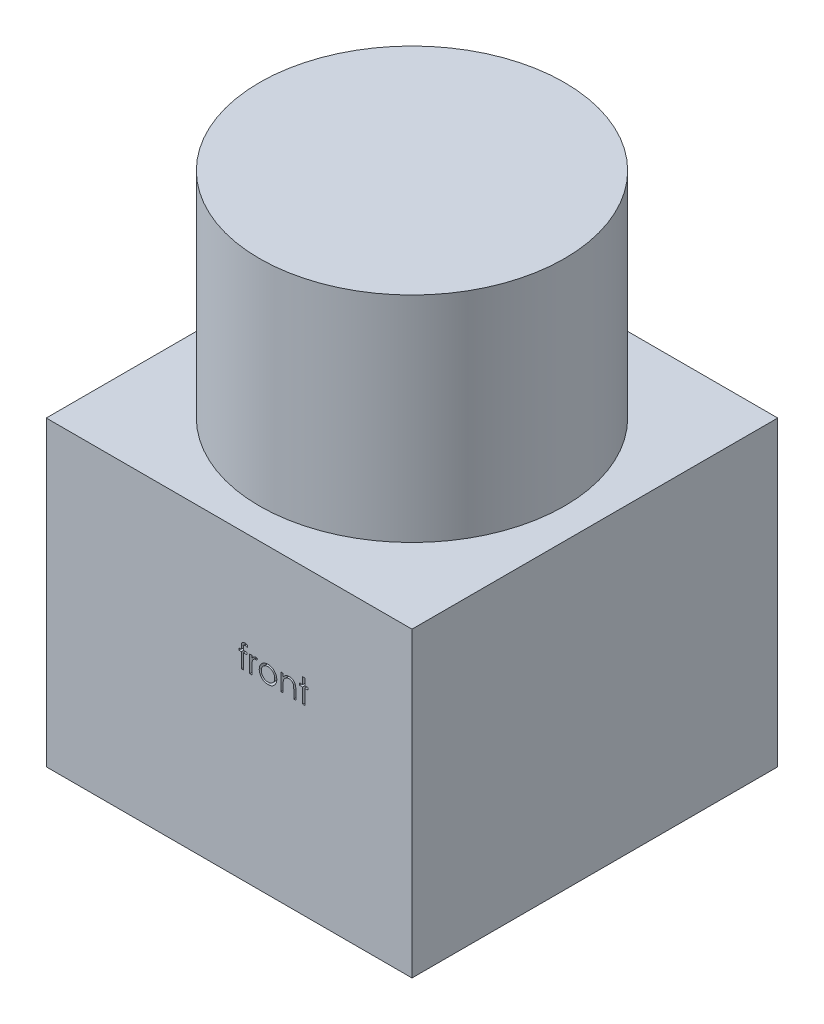
from build123d import *

# Parameters (mm, degrees)
SKETCH1_W           = 50
SKETCH1_H           = 41.3
BOSS_EXTRUDE1_DEPTH = 50
SKETCH2_R           = 20.85
BOSS_EXTRUDE2_DEPTH = 29.3
SKETCH3_R           = 1.7
CUT_EXTRUDE1_DEPTH  = 12.7
CUT_EXTRUDE2_DEPTH  = 2.54


with BuildPart() as part:
    # Sketch1 → Boss-Extrude1 (new body)
    with BuildSketch(Plane.XY):
        with Locations((25, 20.65)):
            Rectangle(SKETCH1_W, SKETCH1_H)
    extrude(amount=BOSS_EXTRUDE1_DEPTH)

    # Sketch2 → Boss-Extrude2 (add)
    with BuildSketch(Plane(origin=(0, 41.3, 0), x_dir=(1, 0, 0), z_dir=(0, 1, 0))):
        with Locations((25, -25)):
            Circle(SKETCH2_R)
    extrude(amount=BOSS_EXTRUDE2_DEPTH)

    # Sketch3 → Cut-Extrude1 (cut)
    with BuildSketch(Plane.XZ):
        with Locations((45.86404504, 45.86404504)):
            Circle(SKETCH3_R)
        with Locations((4.13595496, 4.13595496)):
            Circle(SKETCH3_R)
    extrude(amount=-CUT_EXTRUDE1_DEPTH, mode=Mode.SUBTRACT)

    # Sketch4 → Cut-Extrude2 (cut)
    # profile 1 of 5: a face of its own
    with BuildSketch(Plane.XY.offset(50)):
        with BuildLine():
            Line((27.486215918, 28.180376343), (27.486215918, 27.883992128))
            add(Edge.make_bspline(
                [(27.486215918, 27.883992128), (27.459238597, 27.894833276), (27.408035081, 27.915410001), (27.332524168, 27.93778434), (27.263101583, 27.952240333), (27.218511983, 27.954268654), (27.197463915, 27.955226102)],
                knots=[0, 0, 0, 0, 1.16548392, 2.212112691, 3.15604595, 4, 4, 4, 4], degree=3))
            add(Edge.make_bspline(
                [(27.197463915, 27.955226102), (27.183245572, 27.954635244), (27.155723602, 27.953491539), (27.116169156, 27.947660174), (27.08052823, 27.935774062), (27.048863845, 27.920326075), (27.022601642, 27.90095478), (27.000116996, 27.881491791), (26.983818787, 27.859552377), (26.974969656, 27.839123148), (26.969572155, 27.820208318), (26.967948253, 27.800836948), (26.96397051, 27.777047955), (26.962861249, 27.747870868), (26.960332708, 27.714213409), (26.960556447, 27.675363296), (26.958484602, 27.631931888), (26.958794767, 27.601179247), (26.958957304, 27.585063843)],
                knots=[0, 0, 0, 0, 1.311993654, 2.539582093, 3.670788641, 4.763509788, 5.772417512, 6.671800701, 7.496729179, 8.266799162, 8.712543678, 9.304149002, 10.05334463, 10.934920737, 11.99209668, 13.165090968, 14.514413552, 16, 16, 16, 16], degree=3))
            Line((26.958957304, 27.585063843), (26.958957304, 27.263238923))
            Line((26.958957304, 27.263238923), (27.44551079, 27.263238923))
            Line((27.44551079, 27.263238923), (27.44551079, 26.978303025))
            Line((27.44551079, 26.978303025), (26.958321287, 26.978303025))
            Line((26.958321287, 26.978303025), (26.957049251, 24.943046615))
            Line((26.957049251, 24.943046615), (26.672113354, 24.943046615))
            Line((26.672113354, 24.943046615), (26.672113354, 26.978303025))
            Line((26.672113354, 26.978303025), (26.346472328, 26.978303025))
            Line((26.346472328, 26.978303025), (26.346472328, 27.263238923))
            Line((26.346472328, 27.263238923), (26.672113354, 27.263238923))
            Line((26.672113354, 27.263238923), (26.672113354, 27.6340372))
            add(Edge.make_bspline(
                [(26.672113354, 27.6340372), (26.672136227, 27.65460719), (26.672180107, 27.694068725), (26.675253371, 27.750864431), (26.677880203, 27.803318574), (26.683112266, 27.851023977), (26.689155385, 27.894427264), (26.697806044, 27.932883663), (26.705980645, 27.967429259), (26.720811153, 28.006529526), (26.742965595, 28.050843477), (26.77882513, 28.097673728), (26.821817359, 28.139678931), (26.873169195, 28.175064172), (26.930968288, 28.204469641), (26.995267642, 28.225553322), (27.065367286, 28.237473583), (27.113888062, 28.23924633), (27.138950293, 28.240162)],
                knots=[0, 0, 0, 0, 1.116398763, 2.141702935, 3.087165306, 3.966655413, 4.746276475, 5.464069668, 6.106083417, 6.67047701, 7.730773247, 8.782666744, 9.856985883, 10.980834087, 12.154321827, 13.366232824, 14.639591414, 16, 16, 16, 16], degree=3))
            add(Edge.make_bspline(
                [(27.138950293, 28.240162), (27.164419924, 28.239293519), (27.217892062, 28.237470189), (27.301527551, 28.226191312), (27.391875821, 28.206714021), (27.453866263, 28.189407654), (27.486215918, 28.180376343)],
                knots=[0, 0, 0, 0, 0.864728408, 1.815451418, 2.859995356, 4, 4, 4, 4], degree=3))
        make_face()
    # profile 2 of 5: a face of its own
    with BuildSketch(Plane.XY.offset(50)):
        with BuildLine():
            Line((27.811856944, 27.263238923), (28.096792841, 27.263238923))
            Line((28.096792841, 27.263238923), (28.096792841, 26.921697456))
            add(Edge.make_bspline(
                [(28.096792841, 26.921697456), (28.117828358, 26.953498101), (28.15805862, 27.014316586), (28.224926778, 27.094752309), (28.293419085, 27.161350244), (28.363863434, 27.214421293), (28.436777853, 27.254166051), (28.510562088, 27.283279018), (28.586376978, 27.300494154), (28.637323867, 27.302792545), (28.66284853, 27.303944051)],
                knots=[0, 0, 0, 0, 1.2804753, 2.448899062, 3.506932113, 4.484331642, 5.4025378, 6.288909075, 7.142734305, 8, 8, 8, 8], degree=3))
            add(Edge.make_bspline(
                [(28.66284853, 27.303944051), (28.682648126, 27.302864073), (28.723387082, 27.300641949), (28.785057003, 27.285029272), (28.84859642, 27.26010278), (28.889547014, 27.236662007), (28.910895405, 27.224441847)],
                knots=[0, 0, 0, 0, 0.901110191, 1.854092781, 2.881294221, 4, 4, 4, 4], degree=3))
            Line((28.910895405, 27.224441847), (28.754435069, 26.977667008))
            add(Edge.make_bspline(
                [(28.754435069, 26.977667008), (28.740729028, 26.983781392), (28.714712339, 26.995387664), (28.676653554, 27.00912363), (28.641564056, 27.01721164), (28.619208828, 27.018436933), (28.608787032, 27.019008154)],
                knots=[0, 0, 0, 0, 1.180555205, 2.24091978, 3.179933427, 4, 4, 4, 4], degree=3))
            add(Edge.make_bspline(
                [(28.608787032, 27.019008154), (28.585921831, 27.01748412), (28.539283448, 27.014375532), (28.470808224, 26.989938185), (28.404362545, 26.950454575), (28.351592537, 26.90666578), (28.310732779, 26.864440278), (28.281577003, 26.82756637), (28.254831939, 26.78622004), (28.229277525, 26.741108113), (28.20599453, 26.691460324), (28.184264223, 26.637772694), (28.16461654, 26.579983042), (28.153413104, 26.539721756), (28.147674251, 26.519098298)],
                knots=[0, 0, 0, 0, 1.125678352, 2.296057538, 3.5422874, 4.923748041, 5.663163013, 6.437101912, 7.23742474, 8.08941207, 8.991984279, 9.93940061, 10.944477711, 12, 12, 12, 12], degree=3))
            add(Edge.make_bspline(
                [(28.147674251, 26.519098298), (28.143381294, 26.500704005), (28.133872721, 26.459962043), (28.124627541, 26.391610167), (28.115493049, 26.310852991), (28.109055403, 26.217465724), (28.103088179, 26.111681579), (28.099722604, 25.9933394), (28.096907612, 25.862317717), (28.096832259, 25.770719553), (28.096792841, 25.722804227)],
                knots=[0, 0, 0, 0, 0.566838948, 1.255505196, 2.06880316, 3.007127437, 4.065329342, 5.249902469, 6.561414163, 8, 8, 8, 8], degree=3))
            Line((28.096792841, 25.722804227), (28.096792841, 24.943046615))
            Line((28.096792841, 24.943046615), (27.811856944, 24.943046615))
            Line((27.811856944, 24.943046615), (27.811856944, 27.263238923))
        make_face()
    # profile 3 of 5: a face of its own
    with BuildSketch(Plane.XY.offset(50)):
        with BuildLine():
            add(Edge.make_bspline(
                [(30.316494363, 27.303944051), (30.360029304, 27.30301705), (30.445390683, 27.301199427), (30.570402122, 27.281772994), (30.689732352, 27.252066456), (30.803838398, 27.210998682), (30.911258895, 27.155951484), (31.013558523, 27.090265913), (31.11045681, 27.012448846), (31.168534844, 26.952252598), (31.198014796, 26.921697456)],
                knots=[0, 0, 0, 0, 1.054011418, 2.066658804, 3.057071809, 4.030435133, 4.997543892, 5.974964718, 6.972108034, 8, 8, 8, 8], degree=3))
            add(Edge.make_bspline(
                [(31.198014796, 26.921697456), (31.223398426, 26.892474769), (31.273674442, 26.834594935), (31.338141201, 26.740745914), (31.393677902, 26.643554537), (31.438185017, 26.541730177), (31.47327786, 26.436161725), (31.49819317, 26.326486329), (31.513013104, 26.2129462), (31.51501151, 26.135835575), (31.51602361, 26.096782593)],
                knots=[0, 0, 0, 0, 1.025258237, 2.030674902, 3.01204498, 3.988269485, 4.97094183, 5.956517959, 6.965070386, 8, 8, 8, 8], degree=3))
            add(Edge.make_bspline(
                [(31.51602361, 26.096782593), (31.515133397, 26.057503255), (31.513374294, 25.979885451), (31.496734014, 25.865567883), (31.470852243, 25.754719723), (31.433811933, 25.64780505), (31.386315648, 25.544497057), (31.328357667, 25.445246966), (31.259531272, 25.349858959), (31.18151336, 25.259143006), (31.09528773, 25.175535083), (31.001746652, 25.102665867), (30.90272835, 25.040234912), (30.796916165, 24.989946164), (30.685276374, 24.950295222), (30.567568176, 24.922445921), (30.443974434, 24.905607822), (30.359585455, 24.903445581), (30.316494363, 24.902341487)],
                knots=[0, 0, 0, 0, 0.998656419, 1.973391657, 2.932242238, 3.890759089, 4.846373663, 5.82037756, 6.809684879, 7.83454468, 8.860553229, 9.859544525, 10.845671541, 11.83227036, 12.833544569, 13.85385346, 14.904124723, 16, 16, 16, 16], degree=3))
            add(Edge.make_bspline(
                [(30.316494363, 24.902341487), (30.273192154, 24.903449286), (30.188382588, 24.905618967), (30.06435259, 24.922380502), (29.946433436, 24.950282387), (29.834647493, 24.990076469), (29.728380382, 25.04023652), (29.628788345, 25.102477124), (29.535171279, 25.175556693), (29.448927407, 25.25913715), (29.370914387, 25.349860468), (29.302086729, 25.445246574), (29.244129076, 25.544497159), (29.196632706, 25.647805023), (29.159592418, 25.75471973), (29.133710641, 25.865567881), (29.117070362, 25.979885451), (29.115311259, 26.057503255), (29.114421046, 26.096782593)],
                knots=[0, 0, 0, 0, 1.099876186, 2.154163076, 3.173186993, 4.173200201, 5.163417411, 6.152872554, 7.150605724, 8.17532212, 9.198891216, 10.186952605, 11.159729845, 12.11414092, 13.071450619, 14.029093627, 15.002601286, 16, 16, 16, 16], degree=3))
            add(Edge.make_bspline(
                [(29.114421046, 26.096782593), (29.115440049, 26.135623316), (29.1174575, 26.212521274), (29.132262533, 26.325847965), (29.157080652, 26.435337739), (29.192215562, 26.540498707), (29.237132914, 26.641876852), (29.291889225, 26.739308378), (29.357013584, 26.832733025), (29.40708964, 26.890538055), (29.43242986, 26.919789404)],
                knots=[0, 0, 0, 0, 1.031353054, 2.041901799, 3.029428768, 4.008703097, 4.981709435, 5.96992636, 6.972712378, 8, 8, 8, 8], degree=3))
            add(Edge.make_bspline(
                [(29.43242986, 26.919789404), (29.461865368, 26.950609527), (29.519755473, 27.011222723), (29.617136105, 27.088812941), (29.719184071, 27.15586538), (29.827791682, 27.209818804), (29.941803989, 27.25230803), (30.061745731, 27.281849605), (30.187181377, 27.301129434), (30.272960462, 27.302996495), (30.316494363, 27.303944051)],
                knots=[0, 0, 0, 0, 1.027980169, 2.021703884, 2.998553061, 3.971491411, 4.943284454, 5.930300938, 6.949603206, 8, 8, 8, 8], degree=3))
        make_face()
        with BuildLine():
            add(Edge.make_bspline(
                [(30.315222328, 27.019008154), (30.284436067, 27.018133131), (30.223658286, 27.016405675), (30.134196234, 27.003266704), (30.048071951, 26.98245004), (29.965122043, 26.952873503), (29.885626236, 26.914683787), (29.809508421, 26.867776918), (29.736544708, 26.812774164), (29.668162407, 26.749761598), (29.605404167, 26.68092851), (29.550542003, 26.607587499), (29.503892085, 26.53092817), (29.465029941, 26.450870808), (29.436085563, 26.366604118), (29.415064321, 26.279082402), (29.401937746, 26.188127346), (29.400226531, 26.126295565), (29.399356944, 26.09487454)],
                knots=[0, 0, 0, 0, 1.021534396, 2.016698045, 2.994645724, 3.958388632, 4.93408049, 5.916473867, 6.921342795, 7.962252576, 8.998418191, 10.008913653, 10.997312074, 11.973003931, 12.956656626, 13.948281152, 14.957379055, 16, 16, 16, 16], degree=3))
            add(Edge.make_bspline(
                [(29.399356944, 26.09487454), (29.400814562, 26.054278058), (29.403707663, 25.973701633), (29.427234627, 25.855037257), (29.466592181, 25.741116577), (29.519739213, 25.632607427), (29.58632914, 25.532211861), (29.664785265, 25.442702728), (29.754265565, 25.365427028), (29.85370339, 25.301309404), (29.961067664, 25.250364483), (30.074693041, 25.214261126), (30.193202813, 25.190791805), (30.274193191, 25.18845911), (30.315222328, 25.187277384)],
                knots=[0, 0, 0, 0, 1.016792936, 2.018143844, 3.017858371, 4.030088057, 5.03801393, 6.028138512, 7.003788237, 7.991172063, 8.984598303, 9.972568034, 10.972917682, 12, 12, 12, 12], degree=3))
            add(Edge.make_bspline(
                [(30.315222328, 25.187277384), (30.356249106, 25.188465996), (30.437234825, 25.190812282), (30.555579935, 25.214142925), (30.668894753, 25.250522675), (30.776147511, 25.301252108), (30.875540073, 25.365670513), (30.965663919, 25.442266369), (31.043450159, 25.532448934), (31.109974215, 25.632740407), (31.163991617, 25.740948355), (31.20316495, 25.855058283), (31.226748475, 25.973696278), (31.229633941, 26.054276264), (31.231087713, 26.09487454)],
                knots=[0, 0, 0, 0, 1.02726834, 2.027799167, 3.010890988, 4.004497153, 4.992059811, 5.971914811, 6.958719428, 7.966827853, 8.981595046, 9.981490638, 10.983022906, 12, 12, 12, 12], degree=3))
            add(Edge.make_bspline(
                [(31.231087713, 26.09487454), (31.230218425, 26.126295753), (31.228507799, 26.188127903), (31.215376939, 26.279080272), (31.194371556, 26.366611935), (31.165368732, 26.450841966), (31.126675448, 26.531135452), (31.079125929, 26.607362419), (31.024487784, 26.681182571), (30.960972253, 26.749539088), (30.892661332, 26.812798729), (30.819668047, 26.867798246), (30.743663102, 26.914477636), (30.664398245, 26.953200155), (30.581437702, 26.982180956), (30.495434092, 27.0033869), (30.406353743, 27.01635015), (30.345793753, 27.018116486), (30.315222328, 27.019008154)],
                knots=[0, 0, 0, 0, 1.042956736, 2.052379634, 3.044323526, 4.02829302, 5.004299113, 5.996692471, 7.007513377, 8.048758398, 9.090003419, 10.095195979, 11.07790575, 12.047570684, 13.018257071, 13.989683339, 14.985167495, 16, 16, 16, 16], degree=3))
        make_face(mode=Mode.SUBTRACT)
    # profile 4 of 5: a face of its own
    with BuildSketch(Plane.XY.offset(50)):
        with BuildLine():
            Line((32.085895405, 27.263238923), (32.370831303, 27.263238923))
            Line((32.370831303, 27.263238923), (32.370831303, 26.844739323))
            add(Edge.make_bspline(
                [(32.370831303, 26.844739323), (32.401254729, 26.882696651), (32.460292449, 26.956354168), (32.558612522, 27.053164975), (32.662520203, 27.132943858), (32.771379164, 27.196538014), (32.88533718, 27.244477453), (33.003699611, 27.279099405), (33.127175094, 27.299859214), (33.211144262, 27.30257178), (33.253623771, 27.303944051)],
                knots=[0, 0, 0, 0, 1.12780773, 2.188550248, 3.19190651, 4.159438251, 5.104880172, 6.052711206, 7.014878035, 8, 8, 8, 8], degree=3))
            add(Edge.make_bspline(
                [(33.253623771, 27.303944051), (33.296559417, 27.302360909), (33.380594834, 27.299262319), (33.502948504, 27.274754321), (33.617224369, 27.232893983), (33.723014966, 27.175551604), (33.818380366, 27.104244303), (33.902132196, 27.021170173), (33.97140457, 26.925615297), (34.017847892, 26.836966434), (34.048441873, 26.758327314), (34.067702636, 26.690974905), (34.084059312, 26.615937725), (34.098239541, 26.533442526), (34.107834492, 26.442911311), (34.115402142, 26.34471519), (34.120825672, 26.238885972), (34.121040853, 26.165691674), (34.121151815, 26.127947456)],
                knots=[0, 0, 0, 0, 1.235846778, 2.418850247, 3.575807741, 4.728682307, 5.871620074, 6.994088408, 8.11269785, 9.256955736, 9.865816715, 10.540099792, 11.271859618, 12.076849838, 12.949306005, 13.892391288, 14.913166135, 16, 16, 16, 16], degree=3))
            Line((34.121151815, 26.127947456), (34.121151815, 24.943046615))
            Line((34.121151815, 24.943046615), (33.836215918, 24.943046615))
            Line((33.836215918, 24.943046615), (33.836215918, 26.034452865))
            add(Edge.make_bspline(
                [(33.836215918, 26.034452865), (33.836040651, 26.066041797), (33.835705394, 26.126466048), (33.834647986, 26.212979377), (33.83209909, 26.291435058), (33.828517406, 26.361645527), (33.823275, 26.423543365), (33.817811613, 26.477254637), (33.811130527, 26.522711151), (33.805177027, 26.55007519), (33.802506984, 26.562347496)],
                knots=[0, 0, 0, 0, 1.430800155, 2.736877192, 3.918605307, 4.986035426, 5.920637409, 6.731861385, 7.431261377, 8, 8, 8, 8], degree=3))
            add(Edge.make_bspline(
                [(33.802506984, 26.562347496), (33.792868109, 26.598371214), (33.774316256, 26.667705725), (33.728474715, 26.761753174), (33.670586136, 26.84176153), (33.599921659, 26.907236127), (33.517163854, 26.958191101), (33.422542375, 26.993546045), (33.316970322, 27.015658804), (33.242716704, 27.017860559), (33.204014396, 27.019008154)],
                knots=[0, 0, 0, 0, 1.084156227, 2.086665306, 3.027808233, 3.945421172, 4.874247719, 5.839848303, 6.874090471, 8, 8, 8, 8], degree=3))
            add(Edge.make_bspline(
                [(33.204014396, 27.019008154), (33.181092997, 27.018576349), (33.135732141, 27.01772182), (33.068467524, 27.009148142), (33.003222024, 26.995125115), (32.939340834, 26.976194279), (32.878101621, 26.950193507), (32.817536871, 26.920684721), (32.759927164, 26.8839017), (32.704044082, 26.84290735), (32.652053178, 26.797478355), (32.603676757, 26.749540835), (32.560552981, 26.698490823), (32.52148354, 26.645150871), (32.487757544, 26.588788418), (32.458317957, 26.529947226), (32.433339148, 26.468549848), (32.420926992, 26.425936757), (32.414716519, 26.404615125)],
                knots=[0, 0, 0, 0, 1.023777757, 2.026029729, 3.023749952, 4.003683103, 4.997618607, 5.993177895, 7.010360494, 8.046726602, 9.087585522, 10.09234134, 11.086953743, 12.070360549, 13.043493632, 14.017870808, 15.008233677, 16, 16, 16, 16], degree=3))
            add(Edge.make_bspline(
                [(32.414716519, 26.404615125), (32.411142695, 26.38896219), (32.403362667, 26.354886572), (32.394959639, 26.298966277), (32.387332767, 26.234277942), (32.380949241, 26.160897055), (32.377043613, 26.078566697), (32.372785124, 25.987638472), (32.371234762, 25.887749808), (32.370969555, 25.818206701), (32.370831303, 25.781953867)],
                knots=[0, 0, 0, 0, 0.615963638, 1.340920617, 2.168419149, 3.115676021, 4.16674242, 5.331190069, 6.6087489, 8, 8, 8, 8], degree=3))
            Line((32.370831303, 25.781953867), (32.370831303, 24.943046615))
            Line((32.370831303, 24.943046615), (32.085895405, 24.943046615))
            Line((32.085895405, 24.943046615), (32.085895405, 27.263238923))
        make_face()
    # profile 5 of 5: a face of its own
    with BuildSketch(Plane.XY.offset(50)):
        Polygon((35.057369764, 28.199456871), (35.342305662, 28.199456871), (35.342305662, 27.263238923), (35.749356944, 27.263238923), (35.749356944, 26.978303025), (35.342305662, 26.978303025), (35.342305662, 24.943046615), (35.057369764, 24.943046615), (35.057369764, 26.978303025), (34.650318482, 26.978303025), (34.650318482, 27.263238923), (35.057369764, 27.263238923), align=None)
    extrude(amount=-CUT_EXTRUDE2_DEPTH, mode=Mode.SUBTRACT)


solid = part.part
